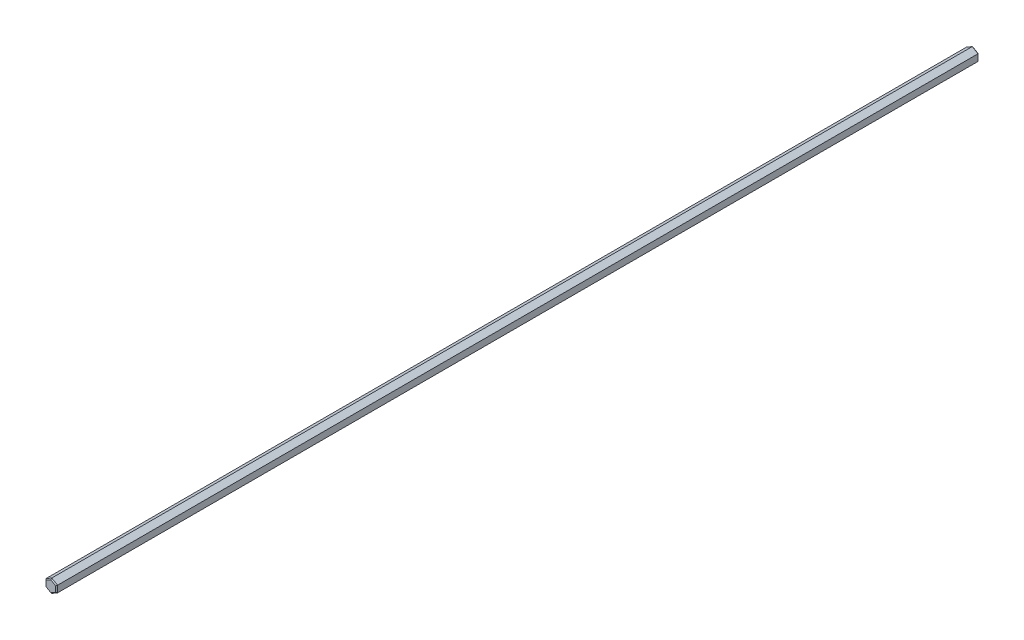
from build123d import *

# Parameters (mm, degrees)
BOSS_EXTRUDE1_DEPTH = 400
CHAMFER1_SIZE       = 0.4


with BuildPart() as part:
    # Sketch1 → Boss-Extrude1 (new body)
    with BuildSketch(Plane.XY.offset(75)):
        Polygon((0, -2.886751346), (2.5, -1.443375673), (2.5, 1.443375673), (0, 2.886751346), (-2.5, 1.443375673), (-2.5, -1.443375673), align=None)
    extrude(amount=-BOSS_EXTRUDE1_DEPTH)

    # Chamfer1
    chamfer1_edges = [part.edges().sort_by_distance(p)[0] for p in [
        (-2.5, 0, -325),
        (-1.25, -2.165063509, -325),
        (-1.25, 2.165063509, -325),
        (1.25, -2.165063509, -325),
        (1.25, 2.165063509, -325),
        (2.5, 0, -325),
        (-1.25, 2.165063509, 75),
        (-2.5, 0, 75),
        (1.25, 2.165063509, 75),
        (-1.25, -2.165063509, 75),
        (2.5, 0, 75),
        (1.25, -2.165063509, 75),
    ]]
    chamfer(chamfer1_edges, length=CHAMFER1_SIZE)


solid = part.part
